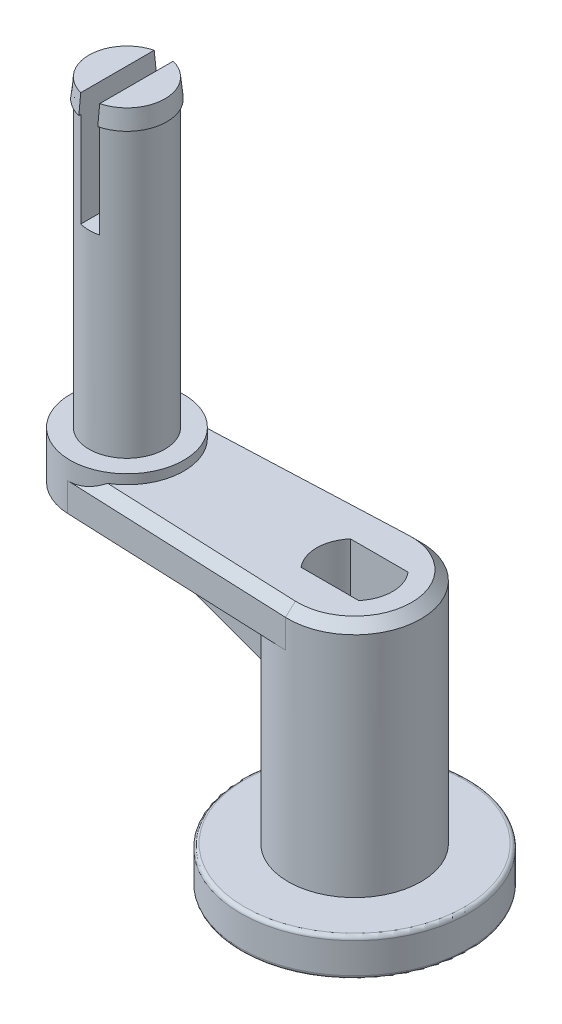
from build123d import *

# Parameters (mm, degrees)
SKETCH_1_R           = 6
EXTRUDE_1_DEPTH      = 2
SKETCH_2_R           = 3.5
EXTRUDE_2_DEPTH      = 12.5
EXTRUDE_START        = -2.5
EXTRUDE_3_DEPTH      = 2.5
EXTRUDE_4_DEPTH      = 0.5
EXTRUDE_4_DEPTH_BACK = 0.5
SKETCH_5_R           = 3
EXTRUDE_5_DEPTH      = 0.5
SKETCH_6_R           = 2
EXTRUDE_6_DEPTH      = 16
SKETCH_8_W           = 1
SKETCH_8_H           = 6
CUT_EXTRUDE_1_DEPTH  = 6
CUT_EXTRUDE_2_DEPTH  = 24.092206478
FILLET_1_R           = 0.2
CHAMFER_1_SIZE       = 0.5


with BuildPart() as part:
    # 草图1 → 凸台-拉伸1 (new body)
    with BuildSketch(Plane(origin=(0, 0, 0), x_dir=(1, 0, 0), z_dir=(0, 1, 0))):
        with Locations(Location((0, 0, 0), (0, 0, 270))):
            Circle(SKETCH_1_R)
    extrude(amount=EXTRUDE_1_DEPTH)

    # 草图2 → 凸台-拉伸2 (add)
    with BuildSketch(Plane(origin=(0, 2, 0), x_dir=(1, 0, 0), z_dir=(0, 1, 0))):
        with Locations(Location((0, 0, 0), (0, 0, 270))):
            Circle(SKETCH_2_R)
    extrude(amount=EXTRUDE_2_DEPTH)

    # 草图3 → 凸台-拉伸3 (add)
    with BuildSketch(Plane(origin=(0, 14.5, 0), x_dir=(1, 0, 0), z_dir=(0, 1, 0)).offset(EXTRUDE_START)):
        with BuildLine():
            Line((-12.125, 2.997394702), (-0.145833333, 3.496960486))
            ThreePointArc((-0.145833333, 3.496960486), (3.5, 0), (-0.145833333, -3.496960486))
            Line((-0.145833333, -3.496960486), (-12.125, -2.997394702))
            ThreePointArc((-12.125, -2.997394702), (-15, 0), (-12.125, 2.997394702))
        make_face()
    extrude(amount=EXTRUDE_3_DEPTH)

    # 草图4 → 凸台-拉伸4 (add, two sides: drawn at the far end of the back side and taken through both)
    with BuildSketch(Plane.XY.offset(-EXTRUDE_4_DEPTH_BACK)):
        Polygon((-14.2, 12), (-3.2, 8), (-0.2, 6.909090909), (-0.2, 12), (-3.2, 12), align=None)
    extrude(amount=EXTRUDE_4_DEPTH + EXTRUDE_4_DEPTH_BACK)

    # 草图5 → 凸台-拉伸5 (add)
    with BuildSketch(Plane(origin=(0, 14.5, 0), x_dir=(1, 0, 0), z_dir=(0, 1, 0))):
        with Locations(Location((-12, 0, 0), (0, 0, 270))):
            Circle(SKETCH_5_R)
    extrude(amount=EXTRUDE_5_DEPTH)

    # 草图6 → 凸台-拉伸6 (add)
    with BuildSketch(Plane(origin=(0, 15, 0), x_dir=(1, 0, 0), z_dir=(0, 1, 0))):
        with Locations(Location((-12, 0, 0), (0, 0, 270))):
            Circle(SKETCH_6_R)
    extrude(amount=EXTRUDE_6_DEPTH)

    # 草图7 → 旋转1 (revolve)
    with BuildSketch(Plane.XY, mode=Mode.PRIVATE) as revolve_1_sk:
        Polygon((-12, 31), (-14, 31), (-14.1, 30), (-12, 30), align=None)
    revolve(revolve_1_sk.sketch.rotate(Axis((-12, 30, 0), (0, 1, 0)), 90), axis=Axis((-12, 30, 0), (0, 1, 0)))

    # 草图8 → 切除-拉伸1 (cut)
    with BuildSketch(Plane(origin=(0, 31, 0), x_dir=(1, 0, 0), z_dir=(0, 1, 0))):
        with Locations((-12, 0)):
            Rectangle(SKETCH_8_W, SKETCH_8_H)
    extrude(amount=-CUT_EXTRUDE_1_DEPTH, mode=Mode.SUBTRACT)

    # 草图9 → 切除-拉伸2 (cut, through all)
    with BuildSketch(Plane(origin=(0, 14.5, 0), x_dir=(1, 0, 0), z_dir=(0, 1, 0))):
        with BuildLine():
            Line((1.519868415, -1.3), (-1.519868415, -1.3))
            ThreePointArc((-1.519868415, -1.3), (-2, 0), (-1.519868415, 1.3))
            Line((-1.519868415, 1.3), (1.519868415, 1.3))
            ThreePointArc((1.519868415, 1.3), (2, 0), (1.519868415, -1.3))
        make_face()
    extrude(amount=-CUT_EXTRUDE_2_DEPTH, mode=Mode.SUBTRACT)

    # 圆角1
    fillet_1_edges = [part.edges().sort_by_distance(p)[0] for p in [
        (0, 0, -6),
        (0, 2, -6),
    ]]
    fillet(fillet_1_edges, radius=FILLET_1_R)

    # 倒角1
    # the kernel refuses this chamfer: 0.5 mm, written as the material it takes off along each edge
    with BuildSketch(Plane(origin=(1.138891494, 12, 3.550537215), x_dir=(-0.0011456615254410918, 0.9996219169112968, 0.02747199829378469), z_dir=(-0.9991315673568166, 0, -0.041666666666666574))) as chamfer_1_piece_1_section:
        Polygon((CHAMFER_1_SIZE * 0.999621916911, CHAMFER_1_SIZE * 0.0274958766106), (-CHAMFER_1_SIZE * 0.0274958766106, CHAMFER_1_SIZE * 0.999621916911), (0, 0), align=None)
    chamfer_1_piece_1 = extrude(amount=13.275420302, mode=Mode.PRIVATE)
    chamfer_1_piece_1 = chamfer_1_piece_1 - Plane(origin=(0, 12.171019003, 0), x_dir=(0, 0, 1), z_dir=(0, -1, 0)) * Cylinder(3.5, 29, mode=Mode.PRIVATE)
    add(chamfer_1_piece_1, mode=Mode.SUBTRACT)
    with BuildSketch(Plane(origin=(-12, 12, 0), x_dir=(-0.041666666666666664, 0, 0.9991315673568165), z_dir=(0.9991315673568165, 0, 0.041666666666666664))) as chamfer_1_piece_2:
        Polygon((3 - CHAMFER_1_SIZE, 0), (3, -CHAMFER_1_SIZE), (3, 0), align=None)
    revolve(axis=Axis((-12, 12, 0), (0, -1, 0)), revolution_arc=175.223969073, mode=Mode.SUBTRACT)
    with BuildSketch(Plane(origin=(-12.125, 12, -2.997394702), x_dir=(0.04165091320463745, -0.027495876610585623, 0.9987538126078094), z_dir=(0.9991315673568165, 0, -0.041666666666666755))) as chamfer_1_piece_3_section:
        Polygon((CHAMFER_1_SIZE * 0.999621916911, -CHAMFER_1_SIZE * 0.0274958766106), (-CHAMFER_1_SIZE * 0.0274958766106, -CHAMFER_1_SIZE * 0.999621916911), (0, 0), align=None)
    chamfer_1_piece_3 = extrude(amount=13.275420302, mode=Mode.PRIVATE)
    chamfer_1_piece_3 = chamfer_1_piece_3 - Plane(origin=(0, 12.143445787, 0), x_dir=(0, 0, 1), z_dir=(0, -1, 0)) * Cylinder(3.5, 29, mode=Mode.PRIVATE)
    add(chamfer_1_piece_3, mode=Mode.SUBTRACT)
    with BuildSketch(Plane(origin=(-13.409724827, 14.5, -2.943817973), x_dir=(0.04165091320463745, 0.027495876610585623, 0.9987538126078094), z_dir=(0.9991315673568165, 0, -0.041666666666666755))) as chamfer_1_piece_4_section:
        Polygon((CHAMFER_1_SIZE * 0.999621916911, CHAMFER_1_SIZE * 0.0274958766106), (-CHAMFER_1_SIZE * 0.0274958766106, CHAMFER_1_SIZE * 0.999621916911), (0, 0), align=None)
    chamfer_1_piece_4 = extrude(amount=13.275420302, mode=Mode.PRIVATE)
    chamfer_1_piece_4 = chamfer_1_piece_4 - Plane(origin=(-12, 14.328980995, 0), x_dir=(0, 0, 1), z_dir=(0, -1, 0)) * Cylinder(3, 29, mode=Mode.PRIVATE)
    add(chamfer_1_piece_4, mode=Mode.SUBTRACT)
    with BuildSketch(Plane(origin=(0, 14.5, 0), x_dir=(0, 0, 1), z_dir=(-1, 0, 0))) as chamfer_1_piece_5:
        Polygon((3.5, -CHAMFER_1_SIZE), (3.5 - CHAMFER_1_SIZE, 0), (3.5, 0), align=None)
    revolve(axis=Axis((0, 14.5, 0), (0, 1, 0)), revolution_arc=182.388015463, mode=Mode.SUBTRACT)
    with BuildSketch(Plane(origin=(-0.145833333, 14.5, 3.496960486), x_dir=(0.04165091320463727, 0.027495876610585623, -0.9987538126078094), z_dir=(-0.9991315673568166, 0, -0.041666666666666574))) as chamfer_1_piece_6_section:
        Polygon((CHAMFER_1_SIZE * 0.999621916911, CHAMFER_1_SIZE * 0.0274958766106), (-CHAMFER_1_SIZE * 0.0274958766106, CHAMFER_1_SIZE * 0.999621916911), (0, 0), align=None)
    chamfer_1_piece_6 = extrude(amount=13.275420302, mode=Mode.PRIVATE)
    chamfer_1_piece_6 = chamfer_1_piece_6 - Plane(origin=(-12, 14.356641066, 0), x_dir=(0, 0, 1), z_dir=(0, -1, 0)) * Cylinder(3, 29, mode=Mode.PRIVATE)
    add(chamfer_1_piece_6, mode=Mode.SUBTRACT)
    with BuildSketch(Plane(origin=(0, 14.5, 0), x_dir=(-0.04166666666666704, 0, 0.9991315673568166), z_dir=(-0.9991315673568166, 0, -0.04166666666666704))) as chamfer_1_piece_7:
        Polygon((3.5, -CHAMFER_1_SIZE), (3.5 - CHAMFER_1_SIZE, 0), (3.5, 0), align=None)
    revolve(axis=Axis((0, 14.5, 0), (0, 1, 0)), revolution_arc=2.388015463, mode=Mode.SUBTRACT)


solid = part.part
